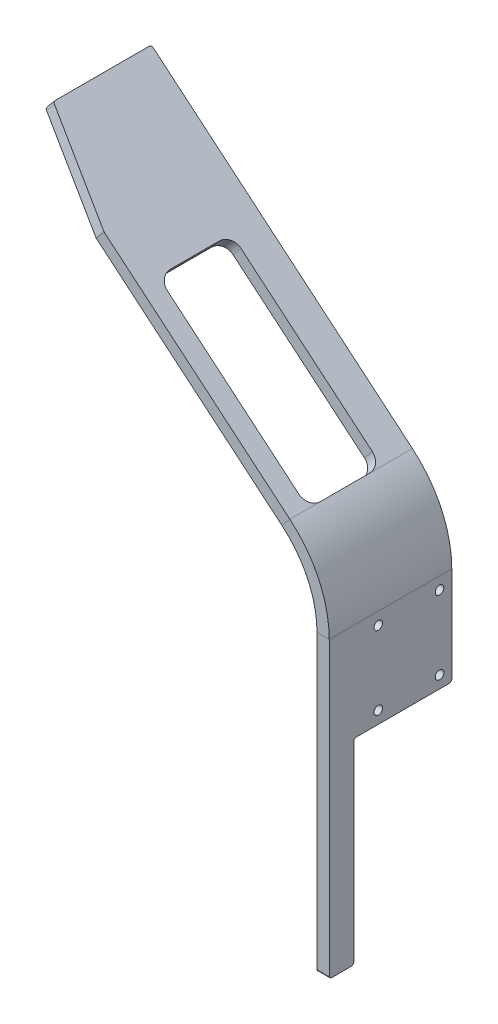
from build123d import *

# Parameters (mm, degrees)
SKETCH1_W          = 5
SKETCH1_H          = 150
BASE_FLANGE1_DEPTH = 50
EDGE_FLANGE2_DEPTH = 50
SKETCH2_W          = 40
SKETCH2_H          = 110
CUT_EXTRUDE1_DEPTH = 10
SKETCH6_R          = 1.75
CUT_EXTRUDE2_DEPTH = 10
SKETCH12_W         = 10
SKETCH12_H         = 30
CUT_EXTRUDE3_DEPTH = 10
CHAMFER1_SIZE      = 10
CHAMFER1_SIZE2     = 40
FILLET1_R          = 1
SKETCH17_W         = 80
SKETCH17_H         = 30
CUT_EXTRUDE6_DEPTH = 10
FILLET2_R          = 5


# Sheet-metal steps are written as plain solids
with BuildPart() as part:
    # Sketch1 → Base-Flange1 (new body)
    with BuildSketch(Plane.XY):
        with Locations((2.5, 75)):
            Rectangle(SKETCH1_W, SKETCH1_H)
    extrude(amount=BASE_FLANGE1_DEPTH)

    # Edge-Flange2 section (across the edge) → Edge-Flange2 (add)
    with BuildSketch(Plane(origin=(0, 168.652306326, 50), x_dir=(-0.6427876096865435, -0.7660444431189746, 0), z_dir=(0, 0, -1))):
        with BuildLine():
            Line((-5, 18.652306326), (-5, 157.668461709))
            Line((-5, 157.668461709), (0, 157.668461709))
            Line((0, 157.668461709), (0, 18.652306326))
            ThreePointArc((0, 18.652306326), (3.747688519, 1.747575857), (14.288495613, -11.989471399))
            Line((14.288495613, -11.989471399), (11.074557564, -15.819693614))
            ThreePointArc((11.074557564, -15.819693614), (-0.783850417, -0.365515452), (-5, 18.652306326))
        make_face()
    extrude(amount=EDGE_FLANGE2_DEPTH)

    # Sketch2 → Cut-Extrude1 (cut)
    with BuildSketch(Plane(origin=(5, 0, 0), x_dir=(0, 0, -1), z_dir=(1, 0, 0))):
        with Locations((-20, 55)):
            Rectangle(SKETCH2_W, SKETCH2_H)
    extrude(amount=-CUT_EXTRUDE1_DEPTH, mode=Mode.SUBTRACT)

    # Sketch6 → Cut-Extrude2 (cut)
    with BuildSketch(Plane.ZY):
        with Locations((30, 115)):
            Circle(SKETCH6_R)
        with Locations((5, 115)):
            Circle(SKETCH6_R)
        with Locations((5, 145)):
            Circle(SKETCH6_R)
        with Locations((30, 145)):
            Circle(SKETCH6_R)
    extrude(amount=-CUT_EXTRUDE2_DEPTH, mode=Mode.SUBTRACT)

    # Sketch12 → Cut-Extrude3 (cut)
    with BuildSketch(Plane.ZY):
        with Locations((45, 15)):
            Rectangle(SKETCH12_W, SKETCH12_H)
    extrude(amount=-CUT_EXTRUDE3_DEPTH, mode=Mode.SUBTRACT)

    # Chamfer1
    chamfer1_edges = [part.edges().sort_by_distance(p)[0] for p in [
        (-119.174079923, 271.914751059, 50),
    ]]
    chamfer1_side = [part.faces().sort_by_distance(p)[0] for p in [
        (-119.174079923, 271.914751059, 25),
    ]]
    chamfer(chamfer1_edges, length=CHAMFER1_SIZE, length2=CHAMFER1_SIZE2, reference=chamfer1_side[0])

    # Fillet1
    fillet1_edges = [part.edges().sort_by_distance(p)[0] for p in [
        (-88.532302198, 246.203246672, 50),
        (-119.174079923, 271.914751059, 40),
        (-119.174079923, 271.914751059, 0),
        (2.5, 110, 0),
        (2.5, 110, 40),
        (2.5, 30, 40),
        (2.5, 30, 50),
    ]]
    fillet(fillet1_edges, radius=FILLET1_R)

    # Sketch17 → Cut-Extrude6 (cut)
    with BuildSketch(Plane(origin=(86.258987465, 102.799458205, 0), x_dir=(0.7660444431189746, -0.6427876096865437, 0), z_dir=(0.6427876096865437, 0.7660444431189746, 0))):
        with Locations((-167.059919178, -27.5)):
            Rectangle(SKETCH17_W, SKETCH17_H)
    extrude(amount=-CUT_EXTRUDE6_DEPTH, mode=Mode.SUBTRACT)

    # Fillet2
    fillet2_edges = [part.edges().sort_by_distance(p)[0] for p in [
        (-12.681526588, 182.556888833, 12.5),
        (-12.681526588, 182.556888833, 42.5),
        (-73.965082038, 233.979897607, 42.5),
        (-73.965082038, 233.979897607, 12.5),
    ]]
    fillet(fillet2_edges, radius=FILLET2_R)


solid = part.part
